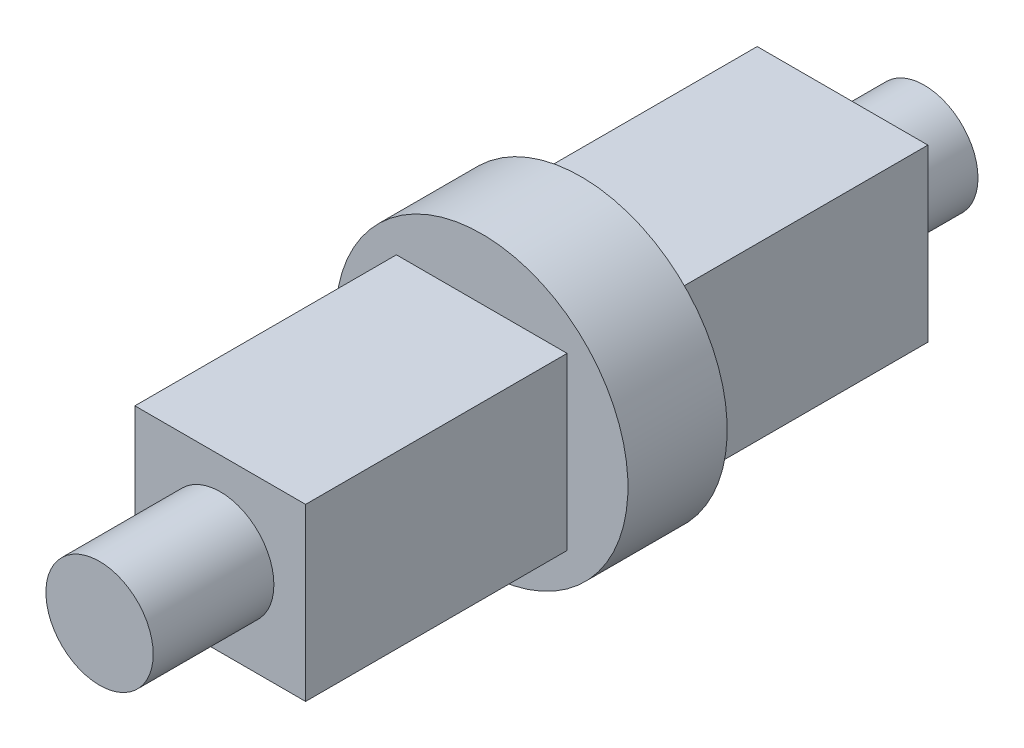
from build123d import *
from build123d.topology import SkipClean

# Parameters (mm, degrees)
SKIZZE1_R                       = 4
AUFSATZ_LINEAR_AUSTRAGEN1_DEPTH = 61.5
SKIZZE3_R                       = 2.25
SCHNITT_LINEAR_AUSTRAGEN1_DEPTH = 18
GEWINDE1_PITCH                  = 0.8
SKIZZE6_W                       = 12.727922062
SKIZZE6_H                       = 12.727922062
AUFSATZ_LINEAR_AUSTRAGEN2_DEPTH = 19.5
SKIZZE8_W                       = 12.727922062
SKIZZE8_H                       = 12.727922062
AUFSATZ_LINEAR_AUSTRAGEN3_DEPTH = 19.5
SKIZZE9_R                       = 10.9
AUFSATZ_LINEAR_AUSTRAGEN4_DEPTH = 7.4


with BuildPart() as part:
    # Skizze1 → Aufsatz-Linear austragen1 (new body)
    with BuildSketch(Plane.XY):
        Circle(SKIZZE1_R)
    extrude(amount=AUFSATZ_LINEAR_AUSTRAGEN1_DEPTH)

    # Skizze3 → Schnitt-Linear austragen1 (cut)
    with BuildSketch(Plane(origin=(0, 0, 0), x_dir=(-1, 0, 0), z_dir=(0, 0, -1))):
        Circle(SKIZZE3_R)
    extrude(amount=-SCHNITT_LINEAR_AUSTRAGEN1_DEPTH, mode=Mode.SUBTRACT)

    # Gewinde1: the profile of Gewindeprofil1 profile screwed along a right-hand helix of 20 turns, 8 arcs to a turn; built about Z, then put on its axis
    with SkipClean():  # the faces are left unmerged after this step: merging them gives an invalid solid
        gewinde1_z = Axis((0, 0, 0), (0, 0, 1))
        gewinde1_corners = [(2.2497, 0, -0.000173205), (2.6830127, 0, 0.249999999), (2.6830127, 0, 0.349999999), (2.2497, 0, 0.600173203)]
        with BuildLine(mode=Mode.PRIVATE) as gewinde1_profile:
            Line(gewinde1_corners[0], gewinde1_corners[1])
            Line(gewinde1_corners[1], gewinde1_corners[2])
            Line(gewinde1_corners[2], gewinde1_corners[3])
            Line(gewinde1_corners[3], gewinde1_corners[0])
        gewinde1_cap = Face(gewinde1_profile.wire())
        gewinde1_turn_angles = [0, 22.5, 45, 67.5, 90, 112.5, 135, 157.5, 180, 202.5, 225, 247.5, 270, 292.5, 315, 337.5, 360]
        gewinde1_turn_weights = [1, 0.9238795325112867, 1, 0.9238795325112867, 1, 0.9238795325112867, 1, 0.9238795325112867, 1, 0.9238795325112867, 1, 0.9238795325112867, 1, 0.9238795325112867, 1, 0.9238795325112867, 1]
        gewinde1_turn_rails = [Edge.make_bspline([Vector(p[0], p[1], 0).rotate(gewinde1_z, gewinde1_turn_angles[k]) / gewinde1_turn_weights[k] + Vector(0, 0, p[2] + GEWINDE1_PITCH * gewinde1_turn_angles[k] / 360) for k in range(17)], [0, 0, 0, 1, 1, 2, 2, 3, 3, 4, 4, 5, 5, 6, 6, 7, 7, 8, 8, 8], 2, gewinde1_turn_weights) for p in gewinde1_corners]
        gewinde1_turn_sides = [Face.make_surface_from_curves(gewinde1_turn_rails[p[0]], gewinde1_turn_rails[p[1]]) for p in [(0, 1), (1, 2), (2, 3), (3, 0)]]
        gewinde1 = Plane(origin=(0, 0, 0), x_dir=(1, 0, 0), z_dir=(0, 0, 1)) * Solid(Shell([*[p.moved(Location((0, 0, GEWINDE1_PITCH * i))) for i in range(20) for p in gewinde1_turn_sides], gewinde1_cap, gewinde1_cap.rotate(gewinde1_z, 7200).moved(Location((0, 0, GEWINDE1_PITCH * 7200 / 360)))]))
        add(gewinde1, mode=Mode.SUBTRACT)

    # Skizze6 → Aufsatz-Linear austragen2 (add)
    with SkipClean():  # the faces are left unmerged after this step: merging them gives an invalid solid
        with BuildSketch(Plane.XY.offset(52.5)):
            Rectangle(SKIZZE6_W, SKIZZE6_H)
        extrude(amount=-AUFSATZ_LINEAR_AUSTRAGEN2_DEPTH)

    # Skizze8 → Aufsatz-Linear austragen3 (add)
    with SkipClean():  # the faces are left unmerged after this step: merging them gives an invalid solid
        with BuildSketch(Plane.XY.offset(25.6)):
            Rectangle(SKIZZE8_W, SKIZZE8_H)
        extrude(amount=-AUFSATZ_LINEAR_AUSTRAGEN3_DEPTH)

    # Skizze9 → Aufsatz-Linear austragen4 (add)
    with SkipClean():  # the faces are left unmerged after this step: merging them gives an invalid solid
        with BuildSketch(Plane(origin=(0, 0, 33), x_dir=(-1, 0, 0), z_dir=(0, 0, -1))):
            Circle(SKIZZE9_R)
        extrude(amount=AUFSATZ_LINEAR_AUSTRAGEN4_DEPTH)


solid = part.part
